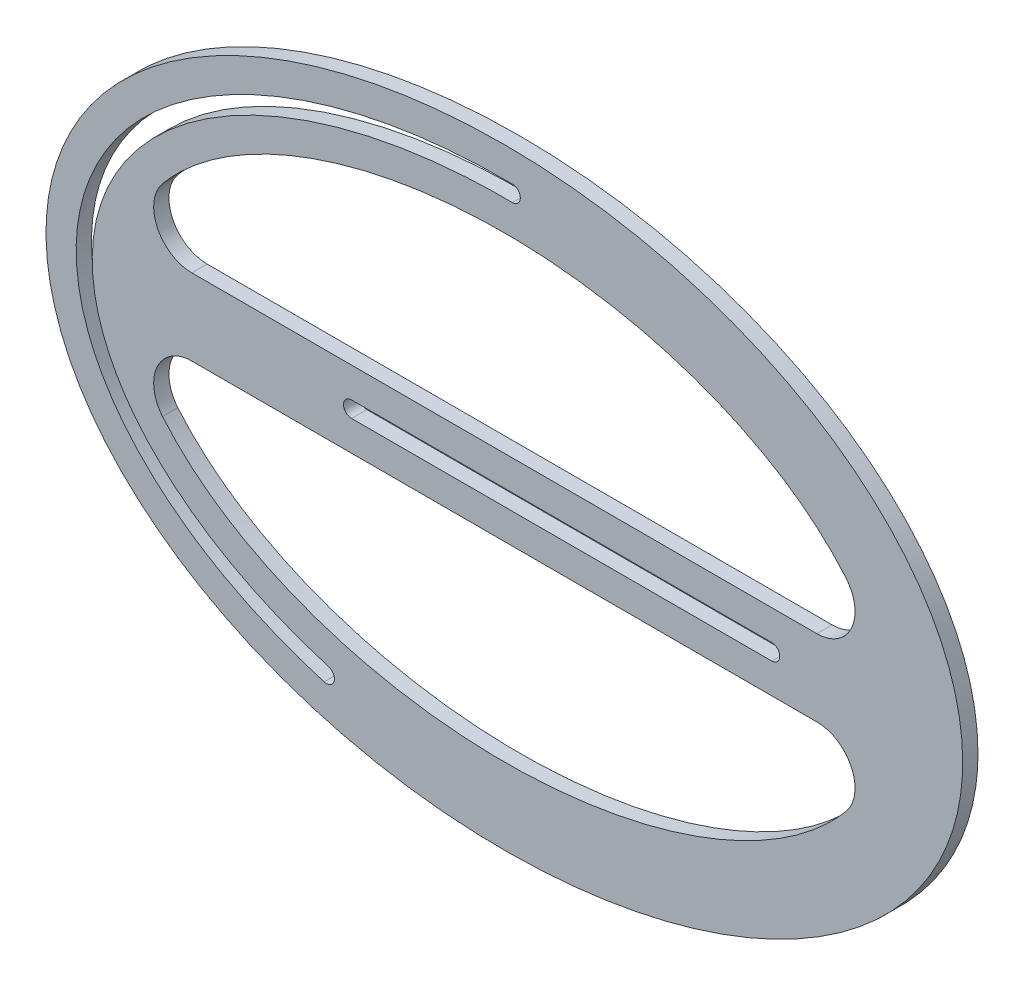
from build123d import *

# Parameters (mm, degrees)
BOSS_EXTRUDE3_START = -2
BOSS_EXTRUDE3_DEPTH = 4
SKETCH8_W           = 220
SKETCH8_H           = 20
BOSS_EXTRUDE4_DEPTH = 4
FILLET1_R           = 10
CUT_EXTRUDE2_DEPTH  = 145.277510516
CUT_EXTRUDE3_DEPTH  = 50
FILLET2_R           = 2.1


# Read off the part's stored shape, not the designer's step: Boss-Extrude3
with BuildPart() as part:
    # Boss-Extrude3 outline → Boss-Extrude3 (new body)
    with BuildSketch(Plane.XY.offset(BOSS_EXTRUDE3_START)):
        with BuildLine():
            add(Edge.make_bspline(
                [(120, 0), (120, 5.60837091), (118.249749071, 16.825112731), (110.711713348, 32.537979104), (98.949654389, 46.48137048), (78.535484317, 62.27182897), (45.689881985, 76.15803027), (0, 81.920984865), (-45.689881985, 76.15803027), (-78.535484317, 62.27182897), (-98.949654389, 46.48137048), (-110.711713348, 32.537979104), (-118.249749071, 16.825112731), (-120.875125464, 0), (-118.249749071, -16.825112731), (-110.711713348, -32.537979104), (-98.949654389, -46.48137048), (-78.535484317, -62.27182897), (-45.689881985, -76.15803027), (0, -81.920984865), (45.689881985, -76.15803027), (78.535484317, -62.27182897), (98.949654389, -46.48137048), (110.711713348, -32.537979104), (118.249749071, -16.825112731), (120, -5.60837091), (120, 0)],
                knots=[0, 0, 0, 0, 0.196349541, 0.392699082, 0.589048623, 0.785398163, 1.178097245, 1.570796327, 1.963495408, 2.35619449, 2.552544031, 2.748893572, 2.945243113, 3.141592654, 3.337942194, 3.534291735, 3.730641276, 3.926990817, 4.319689899, 4.71238898, 5.105088062, 5.497787144, 5.694136685, 5.890486225, 6.086835766, 6.283185307, 6.283185307, 6.283185307, 6.283185307], degree=3))
        make_face()
        with BuildLine():
            add(Edge.make_bspline(
                [(100, 0), (100, 3.554525689), (98.913889193, 10.663577066), (93.852122858, 21.383132202), (85.152345438, 31.799577686), (72.92902589, 41.309877418), (57.609497053, 49.326071478), (33.905278859, 57.40769091), (0, 61.72820606), (-33.905278859, 57.40769091), (-57.609497053, 49.326071478), (-72.92902589, 41.309877418), (-85.152345438, 31.799577686), (-93.852122858, 21.383132202), (-98.913889193, 10.663577066), (-100.543055403, 0), (-98.913889193, -10.663577066), (-93.852122858, -21.383132202), (-85.152345438, -31.799577686), (-72.92902589, -41.309877418), (-57.609497053, -49.326071478), (-33.905278859, -57.40769091), (0, -61.72820606), (33.905278859, -57.40769091), (57.609497053, -49.326071478), (72.92902589, -41.309877418), (85.152345438, -31.799577686), (93.852122858, -21.383132202), (98.913889193, -10.663577066), (100, -3.554525689), (100, 0)],
                knots=[0, 0, 0, 0, 0.196349541, 0.392699082, 0.589048623, 0.785398163, 0.981747704, 1.178097245, 1.570796327, 1.963495408, 2.159844949, 2.35619449, 2.552544031, 2.748893572, 2.945243113, 3.141592654, 3.337942194, 3.534291735, 3.730641276, 3.926990817, 4.123340358, 4.319689899, 4.71238898, 5.105088062, 5.301437603, 5.497787144, 5.694136685, 5.890486225, 6.086835766, 6.283185307, 6.283185307, 6.283185307, 6.283185307], degree=3))
        make_face(mode=Mode.SUBTRACT)
    extrude(amount=BOSS_EXTRUDE3_DEPTH)

    # Sketch8 → Boss-Extrude4 (add)
    with BuildSketch(Plane.XY.offset(2)):
        Rectangle(SKETCH8_W, SKETCH8_H)
    extrude(amount=-BOSS_EXTRUDE4_DEPTH)

    # Fillet1
    fillet1_edges = [part.edges().sort_by_distance(p)[0] for p in [
        (98.545586841, 10, 0),
        (-98.545586841, 10, 0),
        (-98.545586841, -10, 0),
        (98.545586841, -10, 0),
    ]]
    fillet(fillet1_edges, radius=FILLET1_R)

    # Sketch5 → Cut-Extrude2 (cut, through all)
    with BuildSketch(Plane.XY.offset(2)):
        with BuildLine():
            Line((-44.005681824, -61.973763217), (-45.14590297, -66.016026907))
            add(Edge.make_bspline(
                [(-45.14590297, -66.016026907), (-46.605546928, -65.604297976), (-49.523931619, -64.732865694), (-55.212609053, -62.838870119), (-62.087898717, -60.176599945), (-69.881728521, -56.537296626), (-79.595939983, -51.123139145), (-90.329063365, -43.369779285), (-100.567006327, -32.733684024), (-107.836151502, -21.050296353), (-111.871960539, -8.653949625), (-112.498680524, 4.049832352), (-108.753782537, 20.797714724), (-95.769096692, 40.27120857), (-73.497276322, 55.587058546), (-51.70313448, 64.399794748), (-33.854244542, 69.116190381), (-15.026858359, 71.808292394), (-2.16655573, 72.203490206), (4.226749435, 72.048925188)],
                knots=[-1.608769038, -1.608769038, -1.608769038, -1.608769038, -1.565607631, -1.522446224, -1.436123409, -1.349800594, -1.263477779, -1.09083215, -0.918186521, -0.745540891, -0.572895262, -0.400249633, -0.227604003, 0.117687256, 0.462978514, 0.635624144, 0.808269773, 0.980915402, 1.153561032, 1.153561032, 1.153561032, 1.153561032], degree=3))
            Line((4.226749435, 72.048925188), (4.125239586, 67.850152063))
            add(Edge.make_bspline(
                [(-44.005681824, -61.973763217), (-45.423860667, -61.573730555), (-48.260349906, -60.726745284), (-53.781395272, -58.888487114), (-60.443261108, -56.308569602), (-67.972996881, -52.792045101), (-77.324873917, -47.579038076), (-87.586903305, -40.159431381), (-97.253075092, -30.103801292), (-104.006165258, -19.22718442), (-108.924460756, -4.079531964), (-107.265727294, 15.319235385), (-92.81924619, 37.143357418), (-71.494511867, 51.862054935), (-50.386876234, 60.399589228), (-33.025936974, 64.989222932), (-14.667559956, 67.615112581), (-2.113934546, 68.000990798), (4.125239586, 67.850152063)],
                knots=[-1.608769038, -1.608769038, -1.608769038, -1.608769038, -1.565607631, -1.522446224, -1.436123409, -1.349800594, -1.263477779, -1.09083215, -0.918186521, -0.745540891, -0.572895262, -0.227604003, 0.117687256, 0.462978514, 0.635624144, 0.808269773, 0.980915402, 1.153561032, 1.153561032, 1.153561032, 1.153561032], degree=3))
        make_face()
    extrude(amount=-CUT_EXTRUDE2_DEPTH, mode=Mode.SUBTRACT)

    # Sketch9 → Cut-Extrude3 (cut)
    with BuildSketch(Plane.XY.offset(2)):
        with BuildLine():
            Line((-40, 2.1), (70, 2.1))
            ThreePointArc((70, 2.1), (72.1, 0), (70, -2.1))
            Line((70, -2.1), (-40, -2.1))
            ThreePointArc((-40, -2.1), (-42.1, 0), (-40, 2.1))
        make_face()
    extrude(amount=-CUT_EXTRUDE3_DEPTH, mode=Mode.SUBTRACT)

    # Fillet2
    fillet2_edges = [part.edges().sort_by_distance(p)[0] for p in [
        (-44.005681824, -61.973763217, 0),
        (-45.14590297, -66.016026907, 0),
        (4.226749435, 72.048925188, 0),
        (4.125239586, 67.850152063, 0),
    ]]
    fillet(fillet2_edges, radius=FILLET2_R - 0.0001)  # a hair under: the kernel refuses the full size


solid = part.part
